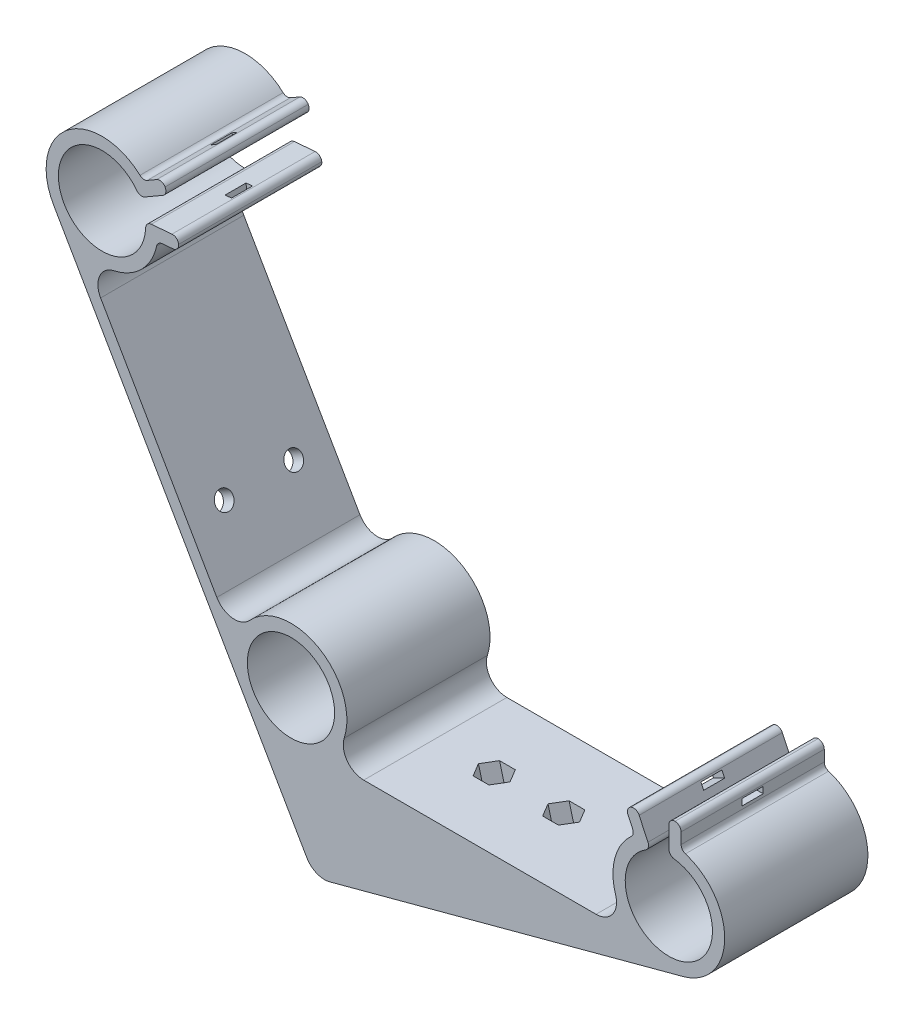
from build123d import *

# Parameters (mm, degrees)
SKETCH3_W               = 114.3
SKETCH3_H               = 19.05
BOSS_EXTRUDE1_DEPTH     = 3.81
BOSS_EXTRUDE2_START     = -22.225
BOSS_EXTRUDE2_OUTLINE_R = 13.5453125
BOSS_EXTRUDE2_DEPTH     = 44.45
SKETCH6_R               = 2.749999961
CUT_EXTRUDE5_DEPTH      = 7.62
CUT_EXTRUDE7_REACH      = 208.672
SKETCH7_RX              = 2.749999961
SKETCH7_RY              = 2.656295985
CUT_EXTRUDE8_REACH      = 221.372
CUT_EXTRUDE8_START      = -12.7
CUT_EXTRUDE9_REACH      = 237.378
SKETCH14_W              = 2
SKETCH14_H              = 6.499999954
MIRROR2_COPY_1_REACH    = 237.378
MIRROR2_COPY_1_SKETCH_W = 2
MIRROR2_COPY_1_SKETCH_H = 6.499999954
FILLET1_R               = 1.905


# Read off the part's stored shape, not the designer's step: Boss-Extrude2
with BuildPart() as part:
    # Sketch3 → Boss-Extrude1 (new body)
    with BuildSketch(Plane(origin=(0, 0, 0), x_dir=(1, 0, 0), z_dir=(0, 1, 0))):
        Rectangle(SKETCH3_W, SKETCH3_H)
    extrude(amount=BOSS_EXTRUDE1_DEPTH)

    # Boss-Extrude2 outline → Boss-Extrude2 (add)
    with BuildSketch(Plane.XY.offset(BOSS_EXTRUDE2_START)):
        with BuildLine():
            ThreePointArc((48.050005342, 31.090690807), (42.090813056, 22.523397373), (42.122274879, 12.087425946))
            ThreePointArc((42.122274879, 12.087425946), (41.198342199, 6.412778013), (36.071859255, 3.81))
            Line((36.071859255, 3.81), (-36.071859255, 3.81))
            ThreePointArc((-36.071859255, 3.81), (-41.198342199, 6.412778013), (-42.122274879, 12.087425946))
            ThreePointArc((-42.122274879, 12.087425946), (-49.981131055, 32.385454016), (-71.489167098, 29.042409074))
            ThreePointArc((-71.489167098, 29.042409074), (-76.865522705, 27.00523428), (-81.682836057, 30.143509735))
            Line((-81.682836057, 30.143509735), (-117.754695312, 92.621802688))
            ThreePointArc((-117.754695312, 92.621802688), (-118.063864905, 98.362856156), (-113.611441977, 102.000329294))
            ThreePointArc((-113.611441977, 102.000329294), (-104.557894696, 107.19106827), (-100.117997084, 116.635526893))
            Line((-100.117997084, 116.635526893), (-93.370404601, 117.225864741))
            Line((-93.370404601, 117.225864741), (-93.702467981, 121.021366541))
            Line((-93.702467981, 121.021366541), (-103.823806114, 120.135864194))
            ThreePointArc((-103.823806114, 120.135864194), (-130.235968745, 114.8821584), (-105.586989883, 125.727968673))
            Line((-105.586989883, 125.727968673), (-96.78817178, 130.807968673))
            Line((-96.78817178, 130.807968673), (-98.69317178, 134.107525461))
            Line((-98.69317178, 134.107525461), (-104.559079836, 130.720841866))
            ThreePointArc((-104.559079836, 130.720841866), (-127.602080191, 132.935148506), (-132.347716126, 110.277656173))
            Line((-132.347716126, 110.277656173), (-53.749017487, -25.859283278))
            ThreePointArc((-53.749017487, -25.859283278), (-50.679795969, -28.55091831), (-46.606255237, -28.817912275))
            Line((-46.606255237, -28.817912275), (63.150672714, 0.591367933))
            ThreePointArc((63.150672714, 0.591367933), (76.010547273, 17.706450636), (62.468787305, 34.28725781))
            Line((62.468787305, 34.28725781), (62.468787305, 41.060625))
            Line((62.468787305, 41.060625), (58.658787305, 41.060625))
            Line((58.658787305, 41.060625), (58.658787305, 30.900625))
            ThreePointArc((58.658787305, 30.900625), (61.590529512, 4.131077991), (52.934290882, 29.631534697))
            Line((52.934290882, 29.631534697), (48.640489342, 38.839621813))
            Line((48.640489342, 38.839621813), (45.187456674, 37.229446236))
            Line((45.187456674, 37.229446236), (48.050005342, 31.090690807))
        make_face()
        with Locations((-58.658787305, 17.3553125)):
            Circle(BOSS_EXTRUDE2_OUTLINE_R, mode=Mode.SUBTRACT)
    extrude(amount=BOSS_EXTRUDE2_DEPTH)

    # Sketch6 → Cut-Extrude5 (cut)
    with BuildSketch(Plane(origin=(-48.209604448, -27.833828106, 0), x_dir=(0, 0, -1), z_dir=(0.8660254037844433, 0.4999999999999923, 0))):
        with Locations(Location((-10.795, 85.238322473, 0), (0, 0, 90))):
            Circle(SKETCH6_R)
        with Locations(Location((10.795, 85.238322473, 0), (0, 0, 90))):
            Circle(SKETCH6_R)
    extrude(amount=-CUT_EXTRUDE5_DEPTH, mode=Mode.SUBTRACT)

    # Cut-Extrude7: up to this plane
    cut_extrude7_end = Plane(origin=(0, 3.81, 0), z_dir=(0, -1, 0))
    # Sketch7 → Cut-Extrude7 (cut, up to the surface)
    with BuildSketch(Plane(origin=(4.082450956, -15.235914386, 0), x_dir=(0.9659258262890681, 0.25881904510252174, 0), z_dir=(0.25881904510252174, -0.9659258262890681, 0)), mode=Mode.PRIVATE) as cut_extrude7_sk1:
        with Locations(Location((4.66627796, 0), (0, 0, -90))):
            Ellipse(SKETCH7_RX, SKETCH7_RY)
    cut_extrude7_tool1 = split(extrude(cut_extrude7_sk1.sketch, amount=-CUT_EXTRUDE7_REACH, mode=Mode.PRIVATE), bisect_by=cut_extrude7_end, keep=Keep.BOTH, mode=Mode.PRIVATE)
    add(cut_extrude7_tool1.solids().sort_by_distance((8.589729, -14.028193, 0))[0], mode=Mode.SUBTRACT)
    # Sketch7 → Cut-Extrude7 (cut, up to the surface)
    with BuildSketch(Plane(origin=(4.082450956, -15.235914386, 0), x_dir=(0.9659258262890681, 0.25881904510252174, 0), z_dir=(0.25881904510252174, -0.9659258262890681, 0)), mode=Mode.PRIVATE) as cut_extrude7_sk2:
        with Locations(Location((-16.18806063, 0), (0, 0, -90))):
            Ellipse(SKETCH7_RX, SKETCH7_RY)
    cut_extrude7_tool2 = split(extrude(cut_extrude7_sk2.sketch, amount=-CUT_EXTRUDE7_REACH, mode=Mode.PRIVATE), bisect_by=cut_extrude7_end, keep=Keep.BOTH, mode=Mode.PRIVATE)
    add(cut_extrude7_tool2.solids().sort_by_distance((-11.554015, -19.425693, 0))[0], mode=Mode.SUBTRACT)

    # Cut-Extrude8: up to this plane
    cut_extrude8_end = Plane(origin=(0, 3.81, 0), z_dir=(0, -1, 0))
    # Sketch11 → Cut-Extrude8 (cut, up to the surface)
    with BuildSketch(Plane(origin=(4.082450956, -15.235914386, 0), x_dir=(0.9659258262890681, 0.25881904510252174, 0), z_dir=(0.25881904510252174, -0.9659258262890681, 0)).offset(CUT_EXTRUDE8_START), mode=Mode.PRIVATE) as cut_extrude8_sk1:
        Polygon((-11.453788359, 0), (-13.820924494, 4.100000055), (-18.555196765, 4.100000055), (-20.9223329, 0), (-18.555196765, -4.100000055), (-13.820924494, -4.100000055), align=None)
    cut_extrude8_tool1 = split(extrude(cut_extrude8_sk1.sketch, amount=-CUT_EXTRUDE8_REACH, mode=Mode.PRIVATE), bisect_by=cut_extrude8_end, keep=Keep.BOTH, mode=Mode.PRIVATE)
    add(cut_extrude8_tool1.solids().sort_by_distance((-14.841017, -7.158435, 0))[0], mode=Mode.SUBTRACT)
    # Sketch11 → Cut-Extrude8 (cut, up to the surface)
    with BuildSketch(Plane(origin=(4.082450956, -15.235914386, 0), x_dir=(0.9659258262890681, 0.25881904510252174, 0), z_dir=(0.25881904510252174, -0.9659258262890681, 0)).offset(CUT_EXTRUDE8_START), mode=Mode.PRIVATE) as cut_extrude8_sk2:
        Polygon((9.400550231, 0), (7.033414095, 4.100000055), (2.299141825, 4.100000055), (-0.067994311, 0), (2.299141825, -4.100000055), (7.033414095, -4.100000055), align=None)
    cut_extrude8_tool2 = split(extrude(cut_extrude8_sk2.sketch, amount=-CUT_EXTRUDE8_REACH, mode=Mode.PRIVATE), bisect_by=cut_extrude8_end, keep=Keep.BOTH, mode=Mode.PRIVATE)
    add(cut_extrude8_tool2.solids().sort_by_distance((5.302727, -1.760935, 0))[0], mode=Mode.SUBTRACT)

    # Sketch14 → Cut-Extrude9 (cut, up to next)
    with BuildSketch(Plane(origin=(-82.743554889, 143.316041067, 0), x_dir=(0.8660254037844421, 0.499999999999994, 0), z_dir=(-0.499999999999994, 0.8660254037844421, 0)), mode=Mode.PRIVATE) as cut_extrude9_sk1:
        with Locations((-21.803714806, 0)):
            Rectangle(SKETCH14_W, SKETCH14_H)
    cut_extrude9_tool1 = extrude(cut_extrude9_sk1.sketch, amount=-CUT_EXTRUDE9_REACH, mode=Mode.PRIVATE) & part.part
    cut_extrude9 = cut_extrude9_tool1.solids().sort_by_distance((-101.626126, 132.414184, 0))[0]
    add(cut_extrude9, mode=Mode.SUBTRACT)

    # Mirror1: Cut-Extrude9 across plane
    add(cut_extrude9.mirror(Plane(origin=(-44.723303861, 141.844198069, 0), x_dir=(0, 0, 1), z_dir=(0.30070579950426285, -0.9537169507482302, 0))), mode=Mode.SUBTRACT)

    # Mirror2: Cut-Extrude9 across plane
    add(cut_extrude9.mirror(Plane(origin=(-51.509161237, 29.738828106, 0), x_dir=(0, 0, 1), z_dir=(0.8660254037844365, -0.500000000000004, 0))), mode=Mode.SUBTRACT)

    # Mirror2 copy 1 sketch → Mirror2 copy 1 (cut, up to next)
    with BuildSketch(Plane(origin=(37.404082957, 53.920945037, 0), x_dir=(-0.42261826174070477, 0.9063077870366477, 0), z_dir=(-0.9063077870366478, -0.42261826174070427, 0)), mode=Mode.PRIVATE) as mirror2_copy_1_sk1:
        with Locations((-21.803714806, 0)):
            Rectangle(MIRROR2_COPY_1_SKETCH_W, MIRROR2_COPY_1_SKETCH_H)
    mirror2_copy_1_tool1 = extrude(mirror2_copy_1_sk1.sketch, amount=-MIRROR2_COPY_1_REACH, mode=Mode.PRIVATE) & part.part
    add(mirror2_copy_1_tool1.solids().sort_by_distance((46.618730656, 34.16006836, 0))[0], mode=Mode.SUBTRACT)

    # Fillet1
    fillet1_edges = [part.edges().sort_by_distance(p)[0] for p in [
        (-105.586989883, 125.727968673, 0),
        (-103.823806114, 120.135864194, 0),
        (-100.117997084, 116.635526893, 0),
        (-104.559079836, 130.720841866, 0),
        (52.934290882, 29.631534697, 0),
        (58.658787305, 30.900625, 0),
        (48.050005342, 31.090690807, 0),
        (62.468787305, 34.28725781, 0),
        (62.468787305, 41.060625, 0),
        (45.187456674, 37.229446236, 0),
        (48.640489342, 38.839621813, 0),
        (58.658787305, 41.060625, 0),
        (-93.370404601, 117.225864741, 0),
        (-93.702467981, 121.021366541, 0),
        (-96.78817178, 130.807968673, 0),
        (-98.69317178, 134.107525461, 0),
    ]]
    fillet(fillet1_edges, radius=FILLET1_R - 0.0001)  # a hair under: the kernel refuses the full size


solid = part.part
